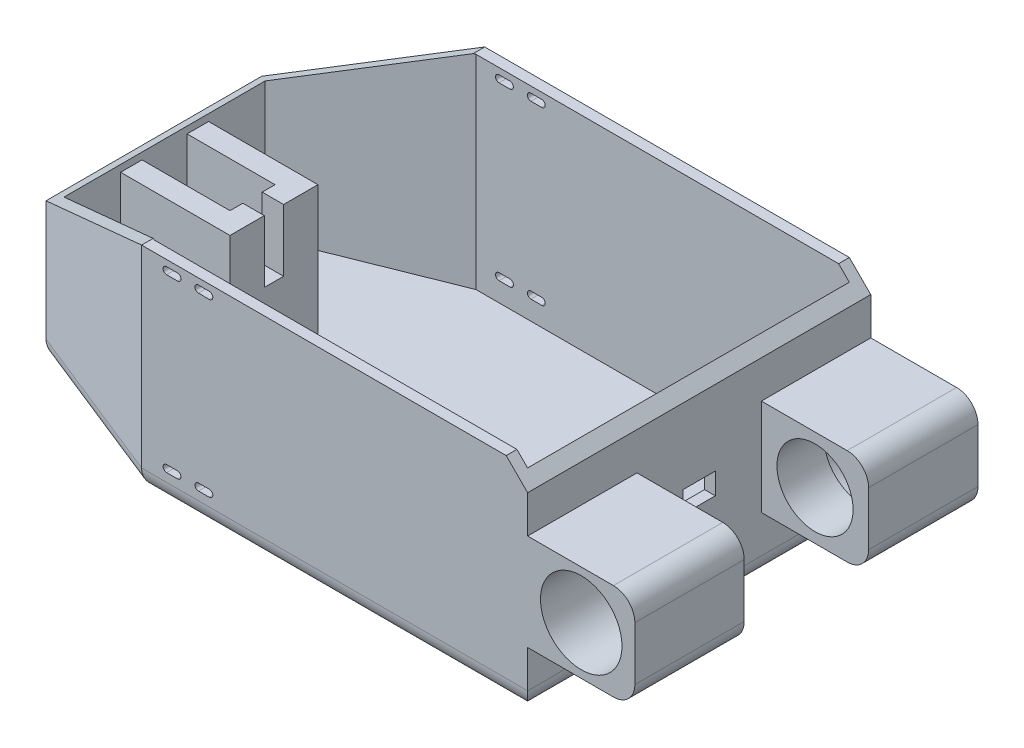
from build123d import *

# Parameters (mm, degrees)
BOSS_EXTRUDE1_DEPTH = 100
SHELL1_T            = -5
CHAMFER1_SIZE       = 10
CHAMFER2_SIZE       = 10
FILLET2_R           = 10
CUT_EXTRUDE1_DEPTH  = 250
BOSS_EXTRUDE5_DEPTH = 60
SKETCH8_W           = 41
SKETCH8_H           = 21
BOSS_EXTRUDE6_DEPTH = 31
SKETCH12_W          = 51
SKETCH12_H          = 45
BOSS_EXTRUDE7_DEPTH = 50
SKETCH26_R          = 19
CUT_EXTRUDE2_DEPTH  = 29
SKETCH28_R          = 17.75
CUT_EXTRUDE3_DEPTH  = 22
BOSS_EXTRUDE8_DEPTH = 60
SKETCH30_W          = 10.5
SKETCH30_H          = 9
CUT_EXTRUDE4_DEPTH  = 29
FILLET4_R           = 10
SKETCH32_W          = 15
SKETCH32_H          = 10
CUT_EXTRUDE7_DEPTH  = 10
CUT_EXTRUDE8_DEPTH  = 10
SKETCH37_W          = 177.863308591
SKETCH37_H          = 31
CUT_EXTRUDE10_DEPTH = 84
FILLET11_R          = 10


with BuildPart() as part:
    # Sketch2 → Boss-Extrude1 (new body)
    with BuildSketch(Plane(origin=(0, 0, 0), x_dir=(1, 0, 0), z_dir=(0, 1, 0))):
        Polygon((-11.910210202, -80), (-11.910210202, 80), (-191.910210202, 80), (-266.188345473, 50.288745892), (-266.188345473, -50.288745892), (-191.910210202, -80), align=None)
    extrude(amount=BOSS_EXTRUDE1_DEPTH)

    # Shell1
    shell1_openings = [part.faces().sort_by_distance(p)[0] for p in [
        (-133.177254811, 100, 0),
    ]]
    offset(amount=SHELL1_T, openings=shell1_openings, kind=Kind.INTERSECTION)

    # Chamfer1
    # the kernel refuses this chamfer: 10 mm, written as the material it takes off along each edge
    with BuildSketch(Plane(origin=(-11.910210202, 100, 105.71682988), x_dir=(0.027495876610586317, -0.9996219169112968, 0), z_dir=(0, 0, -1))) as chamfer1_piece_1:
        Polygon((CHAMFER1_SIZE * 0.999621916911, CHAMFER1_SIZE * 0.0274958766106), (-CHAMFER1_SIZE * 0.0274958766106, CHAMFER1_SIZE * 0.999621916911), (0, 0), align=None)
    extrude(amount=211.433659759, mode=Mode.SUBTRACT)

    # Chamfer2
    # the kernel refuses this chamfer: 10 mm, written as the material it takes off along each edge
    with BuildSketch(Plane(origin=(-266.188345473, 100, -76.005575771), x_dir=(-0.0274958766105877, -0.9996219169112968, 0), z_dir=(0, 0, 1))) as chamfer2_piece_1:
        Polygon((CHAMFER2_SIZE * 0.999621916911, CHAMFER2_SIZE * 0.0274958766106), (-CHAMFER2_SIZE * 0.0274958766106, CHAMFER2_SIZE * 0.999621916911), (0, 0), align=None)
    extrude(amount=152.011151543, mode=Mode.SUBTRACT)

    # Fillet2
    fillet2_edges = [part.edges().sort_by_distance(p)[0] for p in [
        (-11.910210202, 0, 0),
        (-101.910210202, 0, 80),
        (-229.049277838, 0, 65.144372946),
        (-266.188345473, 0, 0),
        (-229.049277838, 0, -65.144372946),
        (-101.910210202, 0, -80),
    ]]
    fillet(fillet2_edges, radius=FILLET2_R)

    # Sketch3 → Cut-Extrude1 (cut)
    with BuildSketch(Plane.XY.offset(80)):
        Polygon((-191.910210202, 100), (-266.188345473, 65.891137916), (-266.188345473, 100), align=None)
    extrude(amount=-CUT_EXTRUDE1_DEPTH, mode=Mode.SUBTRACT)

    # Sketch4 → Boss-Extrude5 (add)
    with BuildSketch(Plane(origin=(0, 5, 0), x_dir=(1, 0, 0), z_dir=(0, 1, 0))):
        Polygon((-215.188345473, -15.5), (-444.051654064, -15.5), (-444.051654064, 15.5), (-261.610116413, 15.5), (-215.188345473, 15.5), align=None)
        Polygon((-261.188345473, 10.5), (-220.188345473, 10.5), (-220.188345473, -10.5), (-384.777774205, -10.5), (-384.777774205, 9.502386243), align=None, mode=Mode.SUBTRACT)
    extrude(amount=BOSS_EXTRUDE5_DEPTH)

    # Sketch8 → Boss-Extrude6 (add)
    with BuildSketch(Plane(origin=(0, 5, 0), x_dir=(1, 0, 0), z_dir=(0, 1, 0))):
        with Locations((-240.688345473, 0)):
            Rectangle(SKETCH8_W, SKETCH8_H)
    extrude(amount=BOSS_EXTRUDE6_DEPTH)

    # Sketch12 → Boss-Extrude7 (add)
    with BuildSketch(Plane(origin=(-11.910210202, 0, 0), x_dir=(0, 0, -1), z_dir=(1, 0, 0))):
        with Locations((-54.5, 50)):
            Rectangle(SKETCH12_W, SKETCH12_H)
    boss_extrude7 = extrude(amount=BOSS_EXTRUDE7_DEPTH)

    # Sketch26 → Cut-Extrude2 (cut)
    with BuildSketch(Plane.XY.offset(80)):
        with Locations((13.089789798, 50)):
            Circle(SKETCH26_R)
    cut_extrude2 = extrude(amount=-CUT_EXTRUDE2_DEPTH, mode=Mode.SUBTRACT)

    # Sketch28 → Cut-Extrude3 (cut)
    with BuildSketch(Plane.XY.offset(51)):
        with Locations((13.089789798, 50)):
            Circle(SKETCH28_R)
    cut_extrude3 = extrude(amount=-CUT_EXTRUDE3_DEPTH, mode=Mode.SUBTRACT)

    # Mirror1: Boss-Extrude7, Cut-Extrude2, Cut-Extrude3 across plane
    add(boss_extrude7.mirror(Plane.XY))
    add(cut_extrude2.mirror(Plane.XY), mode=Mode.SUBTRACT)
    add(cut_extrude3.mirror(Plane.XY), mode=Mode.SUBTRACT)

    # Sketch29 → Boss-Extrude8 (add)
    with BuildSketch(Plane(origin=(0, 65, 0), x_dir=(1, 0, 0), z_dir=(0, 1, 0))):
        Polygon((-261.188345473, 20.5), (-210.188345473, 20.5), (-210.188345473, -20.5), (-261.188345473, -20.5), (-261.188345473, -15.5), (-215.188345473, -15.5), (-215.188345473, 15.5), (-261.188345473, 15.5), align=None)
    extrude(amount=-BOSS_EXTRUDE8_DEPTH)

    # Sketch30 → Cut-Extrude4 (cut)
    with BuildSketch(Plane(origin=(0, 65, 0), x_dir=(1, 0, 0), z_dir=(0, 1, 0))):
        with Locations((-215.438345473, 0)):
            Rectangle(SKETCH30_W, SKETCH30_H)
    extrude(amount=-CUT_EXTRUDE4_DEPTH, mode=Mode.SUBTRACT)

    # Fillet4
    fillet4_edges = [part.edges().sort_by_distance(p)[0] for p in [
        (38.089789798, 72.5, 54.5),
        (38.089789798, 27.5, 54.5),
        (38.089789798, 27.5, -54.5),
        (38.089789798, 72.5, -54.5),
    ]]
    fillet(fillet4_edges, radius=FILLET4_R)

    # Sketch32 → Cut-Extrude7 (cut)
    with BuildSketch(Plane(origin=(-11.910210202, 0, 0), x_dir=(0, 0, -1), z_dir=(1, 0, 0))):
        with Locations((0, 50)):
            Rectangle(SKETCH32_W, SKETCH32_H)
    extrude(amount=-CUT_EXTRUDE7_DEPTH, mode=Mode.SUBTRACT)

    # Sketch34 → Cut-Extrude8 (cut)
    with BuildSketch(Plane(origin=(0, 0, -80), x_dir=(-1, 0, 0), z_dir=(0, 0, -1))):
        with BuildLine():
            Line((175.162205164, 97.108614193), (180.250510852, 97.108614193))
            ThreePointArc((180.250510852, 97.108614193), (181.878966661, 95.480158384), (180.250510852, 93.851702575))
            Line((180.250510852, 93.851702575), (175.162205164, 93.851702575))
            ThreePointArc((175.162205164, 93.851702575), (173.533749356, 95.480158384), (175.162205164, 97.108614193))
        make_face()
        with BuildLine():
            Line((160.318525442, 97.108614193), (165.401872055, 97.108614193))
            ThreePointArc((165.401872055, 97.108614193), (167.030327863, 95.480158384), (165.401872055, 93.851702575))
            Line((165.401872055, 93.851702575), (160.318525442, 93.851702575))
            ThreePointArc((160.318525442, 93.851702575), (158.690069633, 95.480158384), (160.318525442, 97.108614193))
        make_face()
        with BuildLine():
            Line((175.160903312, 17.203664766), (180.240903312, 17.203664766))
            ThreePointArc((180.240903312, 17.203664766), (181.865903312, 15.578664766), (180.240903312, 13.953664766))
            Line((180.240903312, 13.953664766), (175.160903312, 13.953664766))
            ThreePointArc((175.160903312, 13.953664766), (173.535903312, 15.578664766), (175.160903312, 17.203664766))
        make_face()
        with BuildLine():
            Line((160.324224815, 17.203664766), (165.404224815, 17.203664766))
            ThreePointArc((165.404224815, 17.203664766), (167.029224815, 15.578664766), (165.404224815, 13.953664766))
            Line((165.404224815, 13.953664766), (160.324224815, 13.953664766))
            ThreePointArc((160.324224815, 13.953664766), (158.699224815, 15.578664766), (160.324224815, 17.203664766))
        make_face()
    cut_extrude8 = extrude(amount=-CUT_EXTRUDE8_DEPTH, mode=Mode.SUBTRACT)

    # Mirror2: Cut-Extrude8 across plane
    add(cut_extrude8.mirror(Plane.XY), mode=Mode.SUBTRACT)

    # Sketch37 → Cut-Extrude10 (cut)
    with BuildSketch(Plane(origin=(0, 65, 0), x_dir=(1, 0, 0), z_dir=(0, 1, 0))):
        with Locations((-355.119999769, 0)):
            Rectangle(SKETCH37_W, SKETCH37_H)
    extrude(amount=-CUT_EXTRUDE10_DEPTH, mode=Mode.SUBTRACT)

    # Fillet11
    # the kernel refuses this fillet: 10 mm, written as the material it takes off along each edge
    with BuildSketch(Plane(origin=(-266.188345473, 5, 28), x_dir=(0, 1, 0), z_dir=(0, 0, -1))) as fillet11_piece_1:
        with BuildLine():
            CenterArc((5, 10), FILLET11_R, 240, 30)
            Line((0, 1.339745962), (-0.1, 1.166540881))
            ThreePointArc((-0.1, 1.166540881), (-0.2, 0.669872981), (-0.2, 0))
            Line((-0.2, 0), (0, -0.2))
            Line((0, -0.2), (5, -0.2))
            Line((5, -0.2), (5, 0))
        make_face()
    extrude(amount=30, mode=Mode.SUBTRACT)
    with BuildSketch(Plane(origin=(-266.188345473, 5, 2.040359995), x_dir=(0, 1, 0), z_dir=(0, 0, -1))) as fillet11_piece_2:
        with BuildLine():
            CenterArc((5, 10), FILLET11_R, 240, 30)
            Line((0, 1.339745962), (-0.1, 1.166540881))
            ThreePointArc((-0.1, 1.166540881), (-0.2, 0.669872981), (-0.2, 0))
            Line((-0.2, 0), (0, -0.2))
            Line((0, -0.2), (5, -0.2))
            Line((5, -0.2), (5, 0))
        make_face()
    extrude(amount=30.040359995, mode=Mode.SUBTRACT)


solid = part.part
